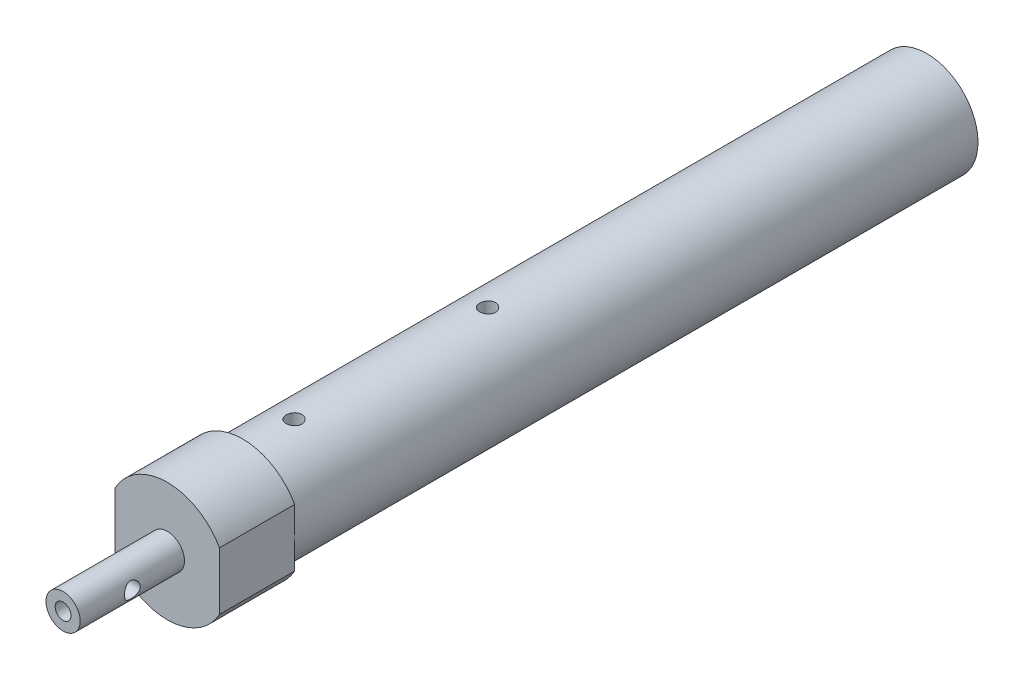
from build123d import *

# Parameters (mm, degrees)
SKETCH1_R                 = 8.73125
BOSS_EXTRUDE1_DEPTH       = 129.54
SKETCH2_R                 = 2.921
BOSS_EXTRUDE2_DEPTH       = 17.78
F_6_32_TAPPED_HOLE1_D     = 2.7051
F_6_32_TAPPED_HOLE2_D     = 2.7051
BOSS_EXTRUDE3_DEPTH       = 12.827
F_6_32_TAPPED_HOLE3_D     = 2.7051
F_6_32_TAPPED_HOLE3_DEPTH = 6.35
F_6_32_TAPPED_HOLE3_TIP   = 0.81269403


with BuildPart() as part:
    # Sketch1 → Boss-Extrude1 (new body)
    with BuildSketch(Plane.XY):
        Circle(SKETCH1_R)
    extrude(amount=BOSS_EXTRUDE1_DEPTH)

    # Sketch2 → Boss-Extrude2 (add)
    with BuildSketch(Plane.XY.offset(129.54)):
        Circle(SKETCH2_R)
    extrude(amount=BOSS_EXTRUDE2_DEPTH)

    # #6-32 Tapped Hole1 (through all)
    with Locations(Plane(origin=(0, 8.73125, 0), x_dir=(1, 0, 0), z_dir=(0, 1, 0))):
        with Locations((0, -74.93), (0, -107.95)):
            Hole(F_6_32_TAPPED_HOLE1_D / 2)

    # #6-32 Tapped Hole2 (through all)
    with Locations(Plane(origin=(2.921, 0, 0), x_dir=(0, 0, -1), z_dir=(1, 0, 0))):
        with Locations((-138.43, 0)):
            Hole(F_6_32_TAPPED_HOLE2_D / 2)

    # Sketch10 → Boss-Extrude3 (add)
    with BuildSketch(Plane.XY.offset(129.54)):
        with BuildLine():
            Line((8.89, -4.91868885), (8.89, 4.91868885))
            ThreePointArc((8.89, 4.91868885), (0, 10.16), (-8.89, 4.91868885))
            Line((-8.89, 4.91868885), (-8.89, -4.91868885))
            ThreePointArc((-8.89, -4.91868885), (0, -10.16), (8.89, -4.91868885))
        make_face()
    extrude(amount=-BOSS_EXTRUDE3_DEPTH)

    # #6-32 Tapped Hole3
    with Locations(Plane.XY.offset(147.32)):
        with Locations((0, 0)):
            Hole(F_6_32_TAPPED_HOLE3_D / 2, depth=F_6_32_TAPPED_HOLE3_DEPTH)
            with Locations((0, 0, -(F_6_32_TAPPED_HOLE3_DEPTH + F_6_32_TAPPED_HOLE3_TIP / 2))):  # 118° drill point
                Cone(0, F_6_32_TAPPED_HOLE3_D / 2, F_6_32_TAPPED_HOLE3_TIP, mode=Mode.SUBTRACT)


solid = part.part
